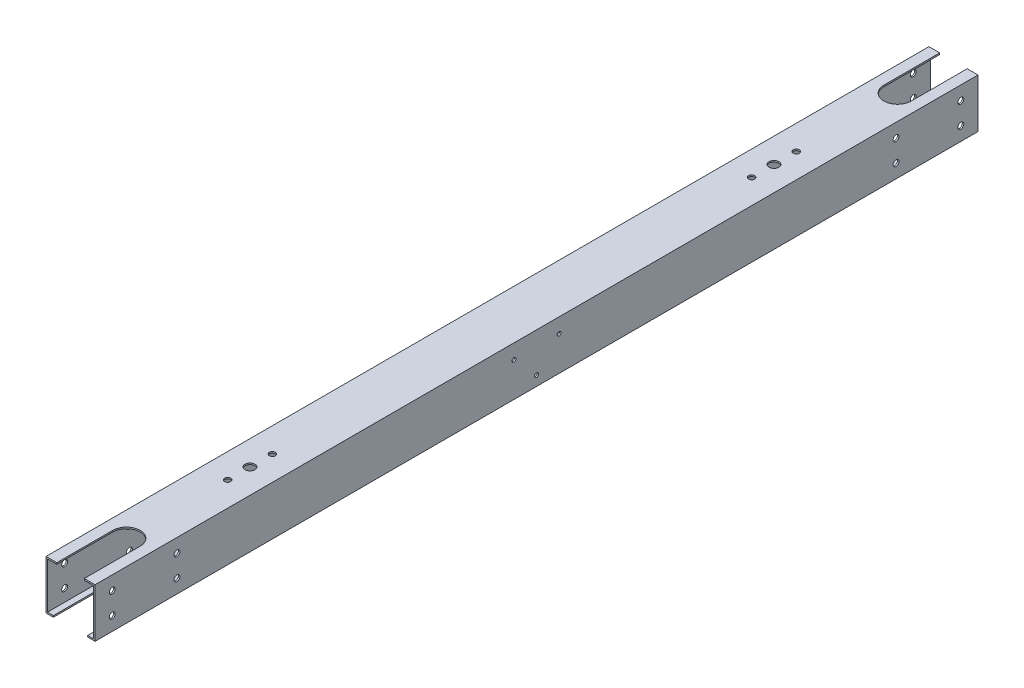
from build123d import *

# Parameters (mm, degrees)
SKETCH1_W           = 50
SKETCH1_H           = 50
SKETCH1_W_2         = 47
SKETCH1_H_2         = 47
BOSS_EXTRUDE1_DEPTH = 900
SKETCH2_R           = 2
CUT_EXTRUDE1_DEPTH  = 59
CUT_EXTRUDE2_DEPTH  = 10
CUT_EXTRUDE3_DEPTH  = 10
SKETCH5_R           = 3
CUT_EXTRUDE4_DEPTH  = 55
SKETCH6_R           = 3.125
SKETCH6_R_2         = 5
CUT_EXTRUDE5_DEPTH  = 10


with BuildPart() as part:
    # Sketch1 → Boss-Extrude1 (new body)
    with BuildSketch(Plane.XY):
        Rectangle(SKETCH1_W, SKETCH1_H)
        Rectangle(SKETCH1_W_2, SKETCH1_H_2, mode=Mode.SUBTRACT)
    extrude(amount=BOSS_EXTRUDE1_DEPTH)

    # Sketch2 → Cut-Extrude1 (cut)
    with BuildSketch(Plane(origin=(25, 0, 0), x_dir=(0, 0, -1), z_dir=(1, 0, 0))):
        with Locations((-450, -15)):
            Circle(SKETCH2_R)
        with Locations((-427, 10)):
            Circle(SKETCH2_R)
        with Locations((-473, 10)):
            Circle(SKETCH2_R)
    extrude(amount=-CUT_EXTRUDE1_DEPTH, mode=Mode.SUBTRACT)

    # Sketch3 → Cut-Extrude2 (cut)
    with BuildSketch(Plane(origin=(0, 25, 0), x_dir=(1, 0, 0), z_dir=(0, 1, 0))):
        with BuildLine():
            Line((14, -843), (14, -913.98611775))
            ThreePointArc((14, -913.98611775), (0, -927.98611775), (-14, -913.98611775))
            Line((-14, -913.98611775), (-14, -843))
            ThreePointArc((-14, -843), (0, -829), (14, -843))
        make_face()
    cut_extrude2 = extrude(amount=-CUT_EXTRUDE2_DEPTH, mode=Mode.SUBTRACT)

    # Sketch4 → Cut-Extrude3 (cut)
    with BuildSketch(Plane.XZ.offset(25)):
        with BuildLine():
            Line((-17.498938419, 850), (-17.498938419, 939.078503923))
            ThreePointArc((-17.498938419, 939.078503923), (0.001061581, 956.578503923), (17.501061581, 939.078503923))
            Line((17.501061581, 939.078503923), (17.501061581, 850))
            ThreePointArc((17.501061581, 850), (0.001061581, 832.5), (-17.498938419, 850))
        make_face()
    cut_extrude3 = extrude(amount=-CUT_EXTRUDE3_DEPTH, mode=Mode.SUBTRACT)

    # Sketch5 → Cut-Extrude4 (cut)
    with BuildSketch(Plane(origin=(25, 0, 0), x_dir=(0, 0, -1), z_dir=(1, 0, 0))):
        with Locations((-882.5, 11)):
            Circle(SKETCH5_R)
        with Locations((-882.5, -11)):
            Circle(SKETCH5_R)
        with Locations((-816.5, -11)):
            Circle(SKETCH5_R)
        with Locations((-816.5, 11)):
            Circle(SKETCH5_R)
    cut_extrude4 = extrude(amount=-CUT_EXTRUDE4_DEPTH, mode=Mode.SUBTRACT)

    # Mirror1: Cut-Extrude2, Cut-Extrude3, Cut-Extrude4 across plane
    add(cut_extrude2.mirror(Plane.XY.offset(450)), mode=Mode.SUBTRACT)
    add(cut_extrude3.mirror(Plane.XY.offset(450)), mode=Mode.SUBTRACT)
    add(cut_extrude4.mirror(Plane.XY.offset(450)), mode=Mode.SUBTRACT)

    # Sketch6 → Cut-Extrude5 (cut)
    with BuildSketch(Plane(origin=(0, 25, 0), x_dir=(1, 0, 0), z_dir=(0, 1, 0))):
        with Locations((0, -694.2275)):
            Circle(SKETCH6_R)
        with Locations((0, -739.8525)):
            Circle(SKETCH6_R)
        with Locations((0, -717.04)):
            Circle(SKETCH6_R_2)
    cut_extrude5 = extrude(amount=-CUT_EXTRUDE5_DEPTH, mode=Mode.SUBTRACT)

    # Mirror2: Cut-Extrude5 across plane
    add(cut_extrude5.mirror(Plane.XY.offset(450)), mode=Mode.SUBTRACT)


solid = part.part
